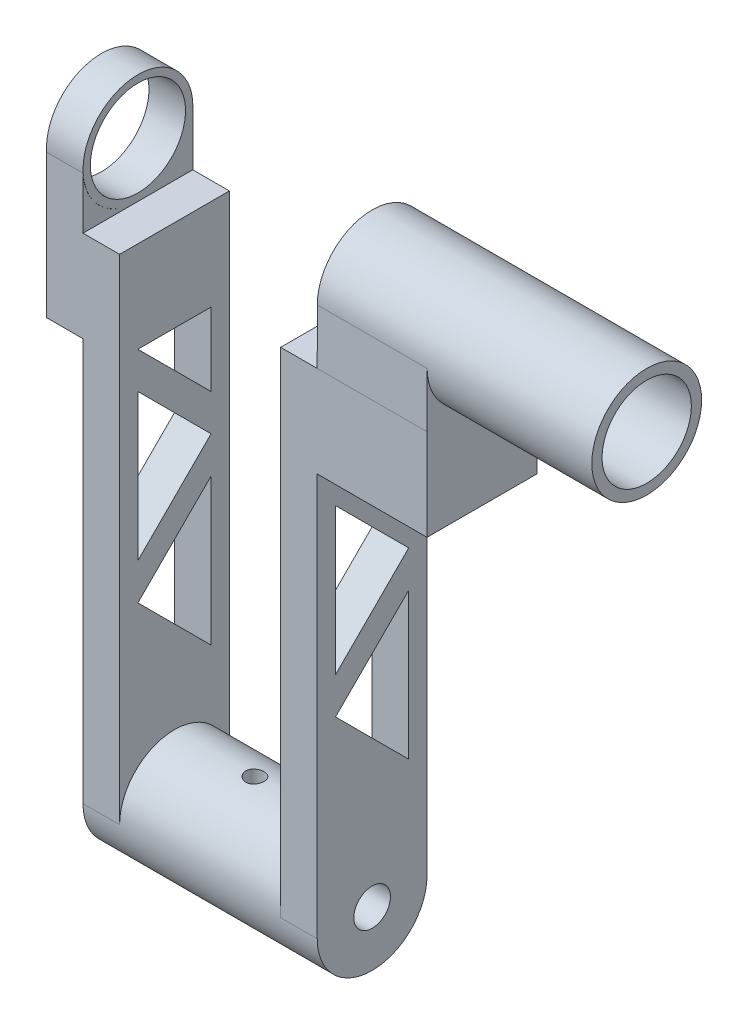
from build123d import *
from build123d.topology import SkipClean

# Parameters (mm, degrees)
CROQUIS2_R                 = 5
SALIENTE_EXTRUIR2_DEPTH    = 64
VACIADO1_START             = 10
VACIADO1_DEPTH             = 44
CORTAR_EXTRUIR1_DEPTH      = 195
CORTAR_EXTRUIR1_DEPTH_BACK = 36
CROQUIS3_R                 = 2.5
CORTAR_EXTRUIR2_DEPTH      = 90
CORTAR_EXTRUIR3_DEPTH      = 90
MATRIZL1_COUNT             = 2
MATRIZL1_PITCH             = 60
CROQUIS7_R                 = 15
CROQUIS7_R_2               = 13
SALIENTE_EXTRUIR3_DEPTH    = 10
SALIENTE_EXTRUIR4_START    = 10
CROQUIS8_R                 = 15
CROQUIS8_R_2               = 13
SALIENTE_EXTRUIR4_DEPTH    = 10
SALIENTE_EXTRUIR5_START    = 65
CROQUIS9_R                 = 15
CROQUIS9_R_2               = 12.2
SALIENTE_EXTRUIR5_DEPTH    = 65
SALIENTE_EXTRUIR8_DEPTH    = 10
SALIENTE_EXTRUIR9_DEPTH    = 10
SALIENTE_EXTRUIR10_START   = 30
SALIENTE_EXTRUIR10_DEPTH   = 30
SALIENTE_EXTRUIR11_DEPTH   = 10
CROQUIS18_W                = 64
CROQUIS18_H                = 30.035928395
CORTAR_EXTRUIR4_DEPTH      = 67


# Read off the part's stored shape, not the designer's step: Vaciado1
with BuildPart() as part:
    # Croquis2 → Saliente-Extruir2 (new body)
    with BuildSketch(Plane(origin=(0, 0, 0), x_dir=(0, 0, -1), z_dir=(1, 0, 0))):
        with BuildLine():
            Line((15, 0), (15, 150))
            ThreePointArc((15, 150), (0, 165), (-15, 150))
            Line((-15, 150), (-15, 0))
            ThreePointArc((-15, 0), (0, -15), (15, 0))
        make_face()
        Circle(CROQUIS2_R, mode=Mode.SUBTRACT)
        with Locations((0, 150)):
            Circle(CROQUIS2_R, mode=Mode.SUBTRACT)
    extrude(amount=SALIENTE_EXTRUIR2_DEPTH)

    # Vaciado1 outline → Vaciado1 (cut)
    with SkipClean():  # the faces are left unmerged after this step: merging them gives an invalid solid
        with BuildSketch(Plane.YZ.offset(VACIADO1_START)):
            with BuildLine():
                ThreePointArc((0, 15), (15, 0), (0, -15))
                Line((0, -15), (150, -15))
                ThreePointArc((150, -15), (135, 0), (150, 15))
                Line((150, 15), (0, 15))
            make_face()
        extrude(amount=VACIADO1_DEPTH, mode=Mode.SUBTRACT)

    # Croquis3 → Cortar-Extruir1 (cut, two sides: drawn at the far end of the back side and taken through both)
    with SkipClean():  # the faces are left unmerged after this step: merging them gives an invalid solid
        with BuildSketch(Plane(origin=(0, 0, 0), x_dir=(1, 0, 0), z_dir=(0, 1, 0)).offset(-CORTAR_EXTRUIR1_DEPTH_BACK)):
            with Locations(Location((32, 0, 0), (0, 0, 90))):
                Circle(CROQUIS3_R)
        extrude(amount=CORTAR_EXTRUIR1_DEPTH + CORTAR_EXTRUIR1_DEPTH_BACK, mode=Mode.SUBTRACT)

    # Croquis4 → Cortar-Extruir2 (cut)
    with SkipClean():  # the faces are left unmerged after this step: merging them gives an invalid solid
        with BuildSketch(Plane(origin=(64, 0, 0), x_dir=(0, 0, -1), z_dir=(1, 0, 0))):
            Polygon((10, 90), (10, 130), (-10, 110), align=None)
        cortar_extruir2 = extrude(amount=-CORTAR_EXTRUIR2_DEPTH, mode=Mode.SUBTRACT)

    # Croquis5 → Cortar-Extruir3 (cut)
    with SkipClean():  # the faces are left unmerged after this step: merging them gives an invalid solid
        with BuildSketch(Plane.ZY):
            Polygon((10, 60), (-10, 80), (10, 100), align=None)
        extrude(amount=-CORTAR_EXTRUIR3_DEPTH, mode=Mode.SUBTRACT)

    # MatrizL1: Cortar-Extruir2 ×2
    with SkipClean():  # the faces are left unmerged after this step: merging them gives an invalid solid
        with Locations(*[(0, -i * MATRIZL1_PITCH, 0) for i in range(1, MATRIZL1_COUNT)]):
            add(cortar_extruir2, mode=Mode.SUBTRACT)

    # Croquis7 → Saliente-Extruir3 (add)
    with SkipClean():  # the faces are left unmerged after this step: merging them gives an invalid solid
        with BuildSketch(Plane.ZY):
            with Locations(Location((-0.021695503, 149.976346025, 0), (0, 0, 183.081975769))):
                Circle(CROQUIS7_R)
            with Locations((-0.021695503, 149.976346025)):
                Circle(CROQUIS7_R_2, mode=Mode.SUBTRACT)
        extrude(amount=SALIENTE_EXTRUIR3_DEPTH)

    # Croquis8 → Saliente-Extruir4 (add)
    with SkipClean():  # the faces are left unmerged after this step: merging them gives an invalid solid
        with BuildSketch(Plane(origin=(64, 0, 0), x_dir=(0, 0, -1), z_dir=(1, 0, 0)).offset(SALIENTE_EXTRUIR4_START)):
            with Locations(Location((0.021695503, 149.976346025, 0), (0, 0, 356.918024231))):
                Circle(CROQUIS8_R)
            with Locations(Location((0.021695503, 149.976346025, 0), (0, 0, 180))):
                Circle(CROQUIS8_R_2, mode=Mode.SUBTRACT)
        extrude(amount=-SALIENTE_EXTRUIR4_DEPTH)

    # Croquis9 → Saliente-Extruir5 (add)
    with SkipClean():  # the faces are left unmerged after this step: merging them gives an invalid solid
        with BuildSketch(Plane(origin=(74, 0, 0), x_dir=(0, 0, -1), z_dir=(1, 0, 0)).offset(SALIENTE_EXTRUIR5_START)):
            with Locations(Location((0.021695503, 149.976346025, 0), (0, 0, 356.918024231))):
                Circle(CROQUIS9_R)
            with Locations((0.021695503, 149.976346025)):
                Circle(CROQUIS9_R_2, mode=Mode.SUBTRACT)
        extrude(amount=-SALIENTE_EXTRUIR5_DEPTH)

    # Croquis14 → Saliente-Extruir8 (add)
    with SkipClean():  # the faces are left unmerged after this step: merging them gives an invalid solid
        with BuildSketch(Plane(origin=(10, 0, 0), x_dir=(0, 0, -1), z_dir=(1, 0, 0))):
            Polygon((-10, 110), (10, 130), (10, 110), align=None)
        extrude(amount=-SALIENTE_EXTRUIR8_DEPTH)

    # Croquis15 → Saliente-Extruir9 (add)
    with SkipClean():  # the faces are left unmerged after this step: merging them gives an invalid solid
        with BuildSketch(Plane.ZY.offset(-54)):
            Polygon((-10, 130), (10, 110), (-10, 110), align=None)
        extrude(amount=-SALIENTE_EXTRUIR9_DEPTH)

    # Croquis16 → Saliente-Extruir10 (add)
    with SkipClean():  # the faces are left unmerged after this step: merging them gives an invalid solid
        with BuildSketch(Plane(origin=(64, 0, 0), x_dir=(0, 0, -1), z_dir=(1, 0, 0)).offset(SALIENTE_EXTRUIR10_START)):
            with BuildLine():
                Line((-14.978304497, 149.976346025), (-15, 134.976346025))
                Line((-15, 134.976346025), (-15, 110))
                Line((-15, 110), (-10, 110))
                Line((-10, 110), (10, 110))
                Line((10, 110), (15, 110))
                Line((15, 110), (15, 134.976346025))
                Line((15, 134.976346025), (15, 149.169875698))
                ThreePointArc((15, 149.169875698), (-0.381685547, 134.981770882), (-14.978304497, 149.976346025))
            make_face()
        extrude(amount=-SALIENTE_EXTRUIR10_DEPTH)

    # Croquis17 → Saliente-Extruir11 (add)
    with SkipClean():  # the faces are left unmerged after this step: merging them gives an invalid solid
        with BuildSketch(Plane.ZY):
            with BuildLine():
                Line((-15, 134.976346025), (-15, 110))
                Line((-15, 110), (-10, 110))
                Line((-10, 110), (10, 110))
                Line((10, 110), (15, 110))
                Line((15, 110), (15, 134.976346025))
                Line((15, 134.976346025), (15, 149.157278959))
                ThreePointArc((15, 149.157278959), (10.317137497, 139.079063564), (-0.010852032, 134.976349945))
                ThreePointArc((-0.010852032, 134.976349945), (-10.160787766, 138.921989052), (-14.966779132, 148.69397505))
                ThreePointArc((-14.966779132, 148.69397505), (-14.985180196, 148.925498609), (-15, 149.157278959))
                Line((-15, 149.157278959), (-15, 134.976346025))
            make_face()
        extrude(amount=SALIENTE_EXTRUIR11_DEPTH)

    # Croquis18 → Cortar-Extruir4 (cut)
    with SkipClean():  # the faces are left unmerged after this step: merging them gives an invalid solid
        with BuildSketch(Plane(origin=(0, 0, -15), x_dir=(-1, 0, 0), z_dir=(0, 0, -1))):
            with Locations((-32, 149.982035803)):
                Rectangle(CROQUIS18_W, CROQUIS18_H)
        extrude(amount=-CORTAR_EXTRUIR4_DEPTH, mode=Mode.SUBTRACT)


solid = part.part
